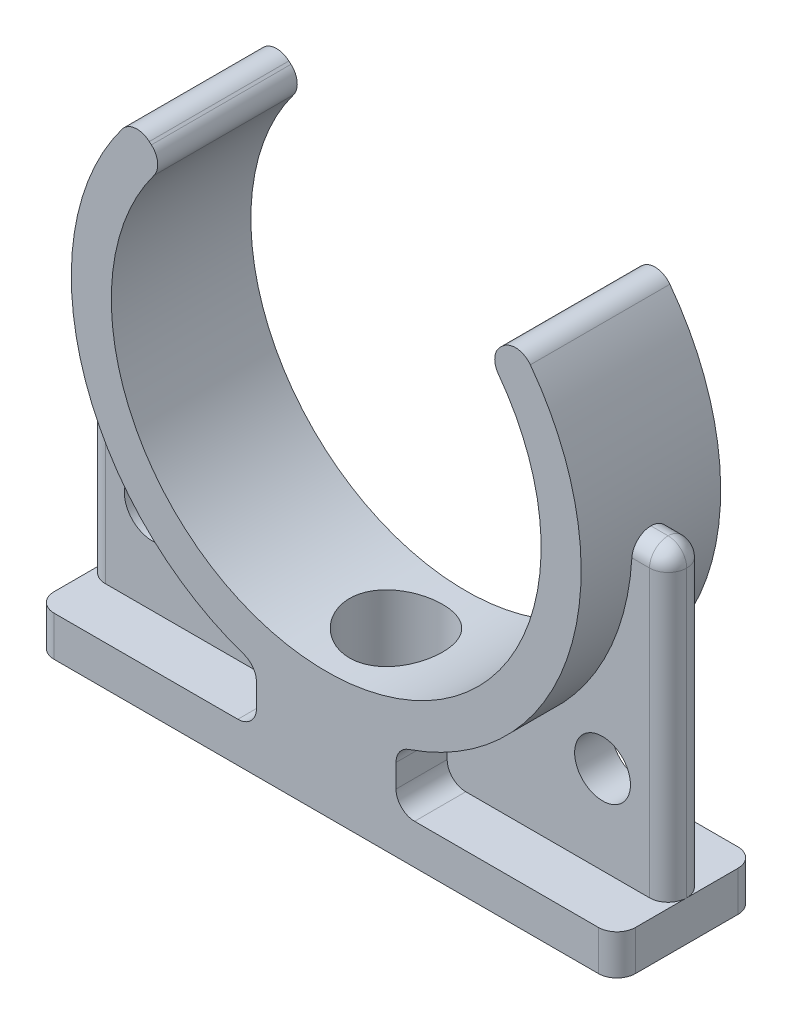
from build123d import *

# Parameters (mm, degrees)
BOSS_EXTRUDE1_DEPTH = 9.525
SKETCH1_3_R         = 3.81
BOSS_EXTRUDE2_DEPTH = 2.54
FILLET1_R           = 2.54
SKETCH2_R           = 2.54
CUT_EXTRUDE1_DEPTH  = 106.176870727
SKETCH7_R           = 6.35
CUT_EXTRUDE2_DEPTH  = 18.415
FILLET2_R           = 2.54
FILLET3_R           = 2.54


with BuildPart() as part:
    # Sketch1 → Boss-Extrude1 (new, symmetric)
    with BuildSketch(Plane.XY):
        with BuildLine():
            ThreePointArc((61.722, 65.850540956), (66.416458594, 34.38975697), (39.6875, 17.145))
            Line((39.6875, 17.145), (39.6875, 0))
            Line((39.6875, 0), (79.375, 0))
            Line((79.375, 0), (79.375, 5.461))
            Line((79.375, 5.461), (49.2125, 5.461))
            Line((49.2125, 5.461), (49.2125, 13.012981804))
            ThreePointArc((49.2125, 13.012981804), (67.609880758, 25.71564604), (74.481791773, 46.99))
            ThreePointArc((74.481791773, 46.99), (72.157634164, 58.995640214), (65.823660173, 69.455940354))
            Line((65.823660173, 69.455940354), (61.722, 65.850540956))
        make_face()
        with BuildLine():
            Line((39.6875, 0), (39.6875, 17.145))
            ThreePointArc((39.6875, 17.145), (12.958541406, 34.38975697), (17.653, 65.850540956))
            Line((17.653, 65.850540956), (13.551339827, 69.455940354))
            ThreePointArc((13.551339827, 69.455940354), (7.217365836, 58.995640214), (4.893208227, 46.99))
            ThreePointArc((4.893208227, 46.99), (11.765119242, 25.71564604), (30.1625, 13.012981804))
            Line((30.1625, 13.012981804), (30.1625, 5.461))
            Line((30.1625, 5.461), (0, 5.461))
            Line((0, 5.461), (0, 0))
            Line((0, 0), (39.6875, 0))
        make_face()
    extrude(amount=BOSS_EXTRUDE1_DEPTH, both=True)

    # Sketch1<3> → Boss-Extrude2 (add, symmetric)
    # profile 1 of 2: a face of its own
    with BuildSketch(Plane.XY):
        with BuildLine():
            Line((0, 46.99), (0, 5.461))
            Line((0, 5.461), (30.1625, 5.461))
            Line((30.1625, 5.461), (30.1625, 13.012981804))
            ThreePointArc((30.1625, 13.012981804), (11.765119242, 25.71564604), (4.893208227, 46.99))
            Line((4.893208227, 46.99), (0, 46.99))
        make_face()
        with Locations((8.9535, 17.526)):
            Circle(SKETCH1_3_R, mode=Mode.SUBTRACT)
    # profile 2 of 2: a face of its own
    with BuildSketch(Plane.XY):
        with BuildLine():
            Line((49.2125, 5.461), (79.375, 5.461))
            Line((79.375, 5.461), (79.375, 46.99))
            Line((79.375, 46.99), (74.481791773, 46.99))
            ThreePointArc((74.481791773, 46.99), (67.609880758, 25.71564604), (49.2125, 13.012981804))
            Line((49.2125, 13.012981804), (49.2125, 5.461))
        make_face()
        with Locations((70.4215, 17.526)):
            Circle(SKETCH1_3_R, mode=Mode.SUBTRACT)
    extrude(amount=BOSS_EXTRUDE2_DEPTH, both=True)

    # Fillet1
    fillet1_edges = [part.edges().sort_by_distance(p)[0] for p in [
        (17.653, 65.850540956, 0),
    ]]
    fillet(fillet1_edges, radius=FILLET1_R)
    fillet1_2_edges = [part.edges().sort_by_distance(p)[0] for p in [
        (61.722, 65.850540956, 0),
    ]]
    fillet(fillet1_2_edges, radius=FILLET1_R)
    fillet1_3_edges = [part.edges().sort_by_distance(p)[0] for p in [
        (0, 2.7305, -9.525),
    ]]
    fillet(fillet1_3_edges, radius=FILLET1_R)
    fillet1_4_edges = [part.edges().sort_by_distance(p)[0] for p in [
        (79.375, 2.7305, -9.525),
    ]]
    fillet(fillet1_4_edges, radius=FILLET1_R)
    fillet1_5_edges = [part.edges().sort_by_distance(p)[0] for p in [
        (13.551339827, 69.455940354, 0),
    ]]
    fillet(fillet1_5_edges, radius=FILLET1_R)
    fillet1_6_edges = [part.edges().sort_by_distance(p)[0] for p in [
        (0, 2.7305, 9.525),
    ]]
    fillet(fillet1_6_edges, radius=FILLET1_R)
    fillet1_7_edges = [part.edges().sort_by_distance(p)[0] for p in [
        (79.375, 2.7305, 9.525),
    ]]
    fillet(fillet1_7_edges, radius=FILLET1_R)
    fillet1_8_edges = [part.edges().sort_by_distance(p)[0] for p in [
        (65.823660173, 69.455940354, 0),
    ]]
    fillet(fillet1_8_edges, radius=FILLET1_R)
    fillet1_9_edges = [part.edges().sort_by_distance(p)[0] for p in [
        (79.375, 26.2255, -2.54),
    ]]
    fillet(fillet1_9_edges, radius=FILLET1_R)
    fillet1_10_edges = [part.edges().sort_by_distance(p)[0] for p in [
        (79.375, 26.2255, 2.54),
    ]]
    fillet(fillet1_10_edges, radius=FILLET1_R - 0.0001)  # a hair under: the kernel refuses the full size
    fillet1_11_edges = [part.edges().sort_by_distance(p)[0] for p in [
        (49.2125, 13.012981804, 6.0325),
    ]]
    fillet(fillet1_11_edges, radius=FILLET1_R)
    fillet1_12_edges = [part.edges().sort_by_distance(p)[0] for p in [
        (49.2125, 5.461, 6.0325),
    ]]
    fillet(fillet1_12_edges, radius=FILLET1_R)
    fillet1_13_edges = [part.edges().sort_by_distance(p)[0] for p in [
        (75.658395887, 46.99, -2.54),
    ]]
    fillet(fillet1_13_edges, radius=FILLET1_R - 0.0001)  # a hair under: the kernel refuses the full size

    # Sketch2 → Cut-Extrude1 (cut, through all)
    with BuildSketch(Plane.XZ):
        with Locations(Location((39.6875, 0, 0), (0, 0, 270))):
            Circle(SKETCH2_R)
    extrude(amount=-CUT_EXTRUDE1_DEPTH, mode=Mode.SUBTRACT)

    # Sketch7 → Cut-Extrude2 (cut)
    with BuildSketch(Plane(origin=(0, 19.05, 0), x_dir=(-1, 0, 0), z_dir=(0, -1, 0))):
        with Locations(Location((-39.6875, 0, 0), (0, 0, 270))):
            Circle(SKETCH7_R)
    extrude(amount=CUT_EXTRUDE2_DEPTH, mode=Mode.SUBTRACT)

    # Fillet2
    fillet2_edges = [part.edges().sort_by_distance(p)[0] for p in [
        (30.1625, 5.461, 6.0325),
    ]]
    fillet(fillet2_edges, radius=FILLET2_R)
    fillet2_2_edges = [part.edges().sort_by_distance(p)[0] for p in [
        (30.1625, 13.012981804, 6.0325),
    ]]
    fillet(fillet2_2_edges, radius=FILLET2_R)
    fillet2_3_edges = [part.edges().sort_by_distance(p)[0] for p in [
        (0, 26.2255, 2.54),
    ]]
    fillet(fillet2_3_edges, radius=FILLET2_R)
    fillet2_4_edges = [part.edges().sort_by_distance(p)[0] for p in [
        (0, 26.2255, -2.54),
    ]]
    fillet(fillet2_4_edges, radius=FILLET2_R - 0.0001)  # a hair under: the kernel refuses the full size
    fillet2_5_edges = [part.edges().sort_by_distance(p)[0] for p in [
        (3.716604113, 46.99, 2.54),
    ]]
    fillet(fillet2_5_edges, radius=FILLET2_R - 0.0001)  # a hair under: the kernel refuses the full size

    # Fillet3
    fillet3_edges = [part.edges().sort_by_distance(p)[0] for p in [
        (30.1625, 5.461, -6.0325),
        (30.1625, 13.012981804, -6.0325),
        (49.2125, 13.012981804, -6.0325),
        (49.2125, 5.461, -6.0325),
    ]]
    fillet(fillet3_edges, radius=FILLET3_R)


solid = part.part
